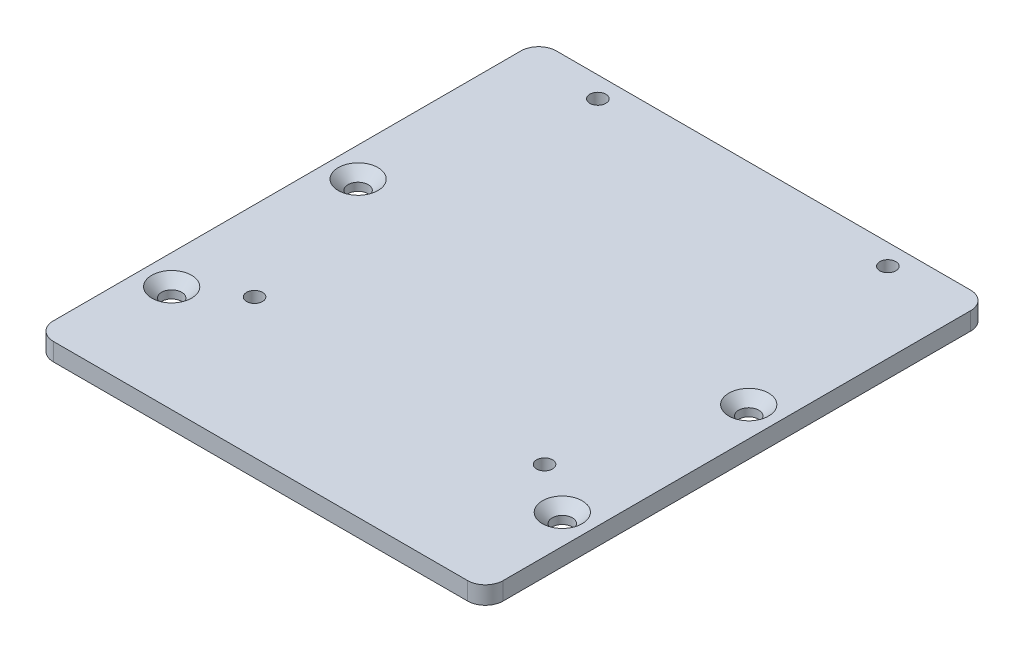
from build123d import *

# Parameters (mm, degrees)
SKETCH1_W                    = 76
SKETCH1_H                    = 85
BOSS_EXTRUDE1_DEPTH          = 3
M2_5_CLEARANCE_HOLE1_D       = 2.7
CSK_FOR_M3_SFHCS1_AT_2_COUNT = 2
CSK_FOR_M3_SFHCS1_AT_2_PITCH = 31.5
CSK_FOR_M3_SFHCS1_AT_3_COUNT = 2
CSK_FOR_M3_SFHCS1_AT_3_PITCH = 73.131730459
CSK_FOR_M3_SFHCS1_AT_4_COUNT = 2
CSK_FOR_M3_SFHCS1_AT_4_PITCH = 66
FILLET1_R                    = 3


with BuildPart() as part:
    # Sketch1 → Boss-Extrude1 (new body)
    with BuildSketch(Plane(origin=(0, 0, 0), x_dir=(1, 0, 0), z_dir=(0, 1, 0))):
        Rectangle(SKETCH1_W, SKETCH1_H)
    extrude(amount=BOSS_EXTRUDE1_DEPTH)

    # M2.5 Clearance Hole1 (through all)
    with Locations(Plane(origin=(0, 3, 0), x_dir=(1, 0, 0), z_dir=(0, 1, 0))):
        with Locations((-24.5, 39), (-24.5, -19), (24.5, -19), (24.5, 39)):
            Hole(M2_5_CLEARANCE_HOLE1_D / 2)

    # Sketch5 → CSK for M3 SFHCS1 (revolve, cut)
    with BuildSketch(Plane(origin=(-33, 3, 24.5), x_dir=(0, 0, 1), z_dir=(1, 0, 0))):
        Polygon((0, 0), (0, 3), (1.7, 3), (1.7, 1.66), (3.36, 0), align=None)
    csk_for_m3_sfhcs1 = revolve(axis=Axis((-33, 9.35, 24.5), (0, -1, 0)), mode=Mode.SUBTRACT)

    # CSK for M3 SFHCS1 at 2: CSK for M3 SFHCS1 ×2
    with Locations(*[(0, 0, -i * CSK_FOR_M3_SFHCS1_AT_2_PITCH) for i in range(1, CSK_FOR_M3_SFHCS1_AT_2_COUNT)]):
        add(csk_for_m3_sfhcs1, mode=Mode.SUBTRACT)

    # CSK for M3 SFHCS1 at 3: CSK for M3 SFHCS1 ×2
    with Locations(*[Vector(0.9024810377836799, 0, -0.43072958621493834) * (i * CSK_FOR_M3_SFHCS1_AT_3_PITCH) for i in range(1, CSK_FOR_M3_SFHCS1_AT_3_COUNT)]):
        add(csk_for_m3_sfhcs1, mode=Mode.SUBTRACT)

    # CSK for M3 SFHCS1 at 4: CSK for M3 SFHCS1 ×2
    with Locations(*[(i * CSK_FOR_M3_SFHCS1_AT_4_PITCH, 0, 0) for i in range(1, CSK_FOR_M3_SFHCS1_AT_4_COUNT)]):
        add(csk_for_m3_sfhcs1, mode=Mode.SUBTRACT)

    # Fillet1
    fillet1_edges = [part.edges().sort_by_distance(p)[0] for p in [
        (-38, 1.5, -42.5),
        (38, 1.5, -42.5),
        (38, 1.5, 42.5),
        (-38, 1.5, 42.5),
    ]]
    fillet(fillet1_edges, radius=FILLET1_R)


solid = part.part
